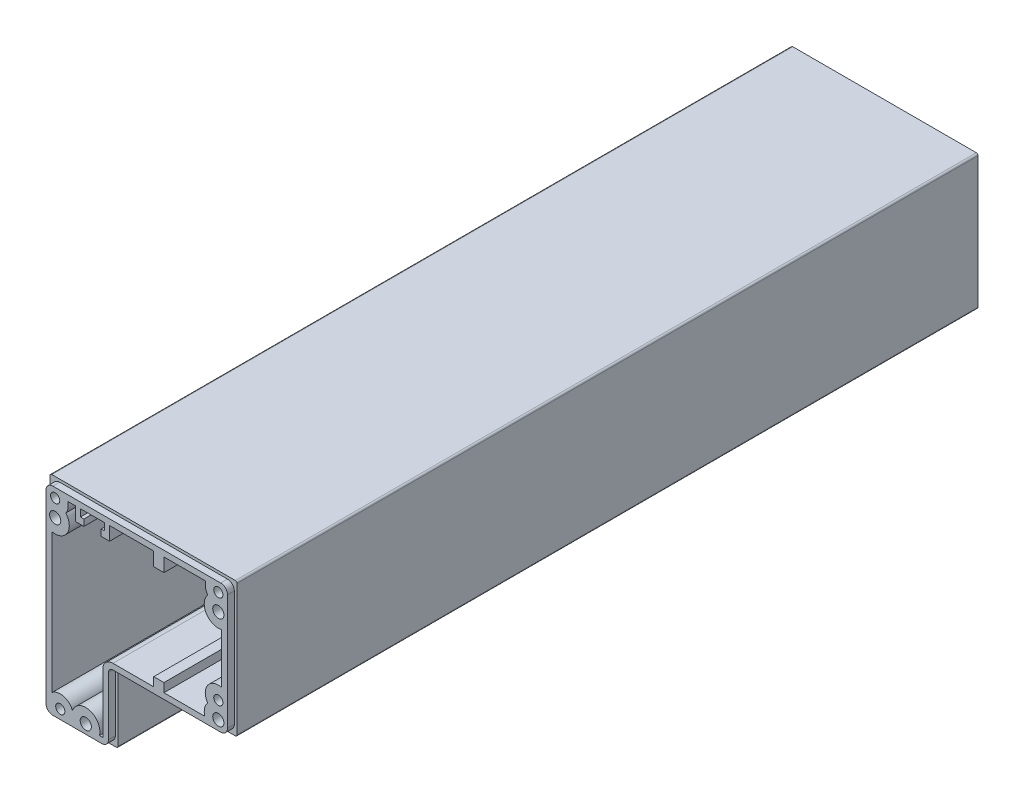
from build123d import *

# Parameters (mm, degrees)
SKETCH_1_W                       = 55
SKETCH_1_H                       = 60
EXTRUDE_1_DEPTH                  = 16.5
HOLE_WIZARD_3_6_3_6_1_D          = 3.6
HOLE_WIZARD_3_6_3_6_1_DEPTH      = 25
HOLE_WIZARD_3_6_3_6_1_TIP        = 1.081549114
HOLE_WIZARD_M2_5_1_D             = 2.05
HOLE_WIZARD_M2_5_1_DEPTH         = 14
HOLE_WIZARD_M2_5_1_TIP           = 0.615882135
SKETCH_8_W                       = 35
SKETCH_8_H                       = 20.4
CUT_EXTRUDE_1_DEPTH              = 44.914690025
CUT_EXTRUDE_START                = 2.5
SKETCH_9_W                       = 20
SKETCH_9_H                       = 6
CUT_EXTRUDE_2_DEPTH              = 42.414690025
SHELL_START                      = 1.8
SHELL_1_DEPTH                    = 14.7
EXTRUDE_2_DEPTH                  = 220
HOLE_WIZARD_1_AT_2_COUNT         = 2
HOLE_WIZARD_1_AT_2_PITCH         = 48
HOLE_WIZARD_1_AT_3_COUNT         = 2
HOLE_WIZARD_1_AT_3_PITCH         = 27.5
HOLE_WIZARD_1_AT_4_COUNT         = 2
HOLE_WIZARD_1_AT_4_PITCH         = 70.507091842
SKETCH_16_R                      = 3
CUT_EXTRUDE_4_DEPTH              = 12
FILLET_1_R                       = 0.5
FILLET_2_R                       = 0.5
SKETCH_20_W                      = 1.65
SKETCH_20_H                      = 220
HOLE_WIZARD_M4_1_AT_2_COUNT      = 2
HOLE_WIZARD_M4_1_AT_2_PITCH      = 27.5
HOLE_WIZARD_M4_1_AT_3_COUNT      = 2
HOLE_WIZARD_M4_1_AT_3_PITCH      = 61.846584384
HOLE_WIZARD_M4_1_AT_4_COUNT      = 2
HOLE_WIZARD_M4_1_AT_4_PITCH      = 48
SKETCH_22_W                      = 1.35
SKETCH_22_H                      = 236.5
HOLE_WIZARD_2_7_2_7_1_AT_2_COUNT = 2
HOLE_WIZARD_2_7_2_7_1_AT_2_PITCH = 27.5
HOLE_WIZARD_2_7_2_7_1_AT_3_COUNT = 2
HOLE_WIZARD_2_7_2_7_1_AT_3_PITCH = 48
HOLE_WIZARD_2_7_2_7_1_AT_4_COUNT = 2
HOLE_WIZARD_2_7_2_7_1_AT_4_PITCH = 70.507091842
SHELL_START_2                    = 16.5
SHELL_2_DEPTH                    = 220
EXTRUDE_1_2_DEPTH                = 220
SKETCH_25_W                      = 10
SKETCH_25_H                      = 4
EXTRUDE_3_DEPTH                  = 220
SKETCH_26_W                      = 7.1
SKETCH_26_H                      = 2.1
CUT_EXTRUDE_5_DEPTH              = 224.732541218
CUT_EXTRUDE_1_2_DEPTH            = 224.732541218
CUT_EXTRUDE_1_2_DEPTH_BACK       = 224.732541218
SKETCH_27_W                      = 5.1
SKETCH_27_H                      = 2.702569417
SKETCH_28_R                      = 75.950047439
CUT_EXTRUDE_6_DEPTH              = 2
FILLET_3_R                       = 2


# Read off the part's stored shape, not the designer's step: 抽壳1, 抽壳2
with BuildPart() as part:
    # 草图1 → Extrude 1 (new body)
    with BuildSketch(Plane.XY):
        Rectangle(SKETCH_1_W, SKETCH_1_H)
    extrude(amount=EXTRUDE_1_DEPTH)

    # Ø3.6 (3.6) 直径孔1
    with Locations(Plane.XY.offset(16.5)):
        with Locations((-24, 21.5), (24, 21.5), (24, -6), (-15, -26.5)):
            Hole(HOLE_WIZARD_3_6_3_6_1_D / 2, depth=HOLE_WIZARD_3_6_3_6_1_DEPTH)
            with Locations((0, 0, -(HOLE_WIZARD_3_6_3_6_1_DEPTH + HOLE_WIZARD_3_6_3_6_1_TIP / 2))):  # 118° drill point
                Cone(0, HOLE_WIZARD_3_6_3_6_1_D / 2, HOLE_WIZARD_3_6_3_6_1_TIP, mode=Mode.SUBTRACT)

    # M2.5 螺纹孔1
    with Locations(Plane.XY.offset(16.5)):
        with Locations((-24, 26.5), (24, 26.5), (24, -1), (-22.5, -26.5)):
            Hole(HOLE_WIZARD_M2_5_1_D / 2, depth=HOLE_WIZARD_M2_5_1_DEPTH)
            with Locations((0, 0, -(HOLE_WIZARD_M2_5_1_DEPTH + HOLE_WIZARD_M2_5_1_TIP / 2))):  # 118° drill point
                Cone(0, HOLE_WIZARD_M2_5_1_D / 2, HOLE_WIZARD_M2_5_1_TIP, mode=Mode.SUBTRACT)

    # 草图8 → Cut-Extrude 1 (cut, through all)
    with BuildSketch(Plane.XY.offset(16.5)):
        with Locations((10, -19.8)):
            Rectangle(SKETCH_8_W, SKETCH_8_H)
    extrude(amount=-CUT_EXTRUDE_1_DEPTH, mode=Mode.SUBTRACT)

    # 草图9 → 切除-拉伸2 (cut, through all)
    with BuildSketch(Plane(origin=(0, 0, 16.5), x_dir=(-1, 0, 0), z_dir=(0, 0, -1)).offset(CUT_EXTRUDE_START)):
        with Locations((17.5, -27)):
            Rectangle(SKETCH_9_W, SKETCH_9_H)
    extrude(amount=CUT_EXTRUDE_2_DEPTH, mode=Mode.SUBTRACT)

    # 抽壳1 outline → 抽壳1 (cut)
    with BuildSketch(Plane.XY.offset(SHELL_START)):
        with BuildLine():
            ThreePointArc((-21.743758657, 28.2), (-21.182110509, 26.299690696), (-22.006919283, 24.4979375))
            ThreePointArc((-22.006919283, 24.4979375), (-20.910890356, 19.651378458), (-25.7, 18.326673669))
            Line((-25.7, 18.326673669), (-25.7, -22.2))
            Line((-25.7, -22.2), (-9.3, -22.2))
            Line((-9.3, -22.2), (-9.3, -7.8))
            Line((-9.3, -7.8), (20.882308546, -7.8))
            ThreePointArc((20.882308546, -7.8), (20.494996561, -5.178446051), (22.006919283, -3.0020625))
            ThreePointArc((22.006919283, -3.0020625), (21.865811165, 0.8509087), (25.7, 1.256241343))
            Line((25.7, 1.256241343), (25.7, 18.326673669))
            ThreePointArc((25.7, 18.326673669), (20.910890356, 19.651378458), (22.006919283, 24.4979375))
            ThreePointArc((22.006919283, 24.4979375), (21.182110509, 26.299690696), (21.743758657, 28.2))
            Line((21.743758657, 28.2), (-21.743758657, 28.2))
        make_face()
    extrude(amount=SHELL_1_DEPTH, mode=Mode.SUBTRACT)


with BuildPart() as body_2:
    # 草图10 → 凸台-拉伸2 (new body)
    with BuildSketch(Plane.XY.offset(16.5)):
        Polygon((-27.5, -30), (-7.5, -30), (-7.5, -9.6), (27.5, -9.6), (27.5, 30), (-27.5, 30), align=None)
    extrude(amount=EXTRUDE_2_DEPTH)


with BuildPart() as hole_wizard_1_tool:
    # 草图13 → 打孔尺寸(%根据)内六角圆柱头螺钉的类型1 (revolve)
    with BuildSketch(Plane(origin=(24, 26.5, 236.5), x_dir=(0, -1, 0), z_dir=(1, 0, 0))):
        Polygon((0, 0), (0, 236.5), (1, 236.5), (1, 1.5), (1.05, 1.5), (1.05, 0), align=None)
    hole_wizard_1 = revolve(axis=Axis((24, 26.5, 242.85), (0, 0, -1)))


with BuildPart() as part_1:
    add(part.part)

    # 打孔尺寸(%根据)内六角圆柱头螺钉的类型1: cut by hole_wizard_1_tool
    add(hole_wizard_1_tool.part, mode=Mode.SUBTRACT)


with BuildPart() as body_2_1:
    add(body_2.part)

    # 打孔尺寸(%根据)内六角圆柱头螺钉的类型1: cut by hole_wizard_1_tool
    add(hole_wizard_1_tool.part, mode=Mode.SUBTRACT)


with BuildPart() as hole_wizard_1_at_2_tool:
    # 打孔尺寸(%根据)内六角圆柱头螺钉的类型1 at 2: 打孔尺寸(%根据)内六角圆柱头螺钉的类型1 ×2
    with Locations(*[(-i * HOLE_WIZARD_1_AT_2_PITCH, 0, 0) for i in range(1, HOLE_WIZARD_1_AT_2_COUNT)]):
        add(hole_wizard_1)


with BuildPart() as part_2:
    add(part_1.part)

    # 打孔尺寸(%根据)内六角圆柱头螺钉的类型1 at 2: cut by hole_wizard_1_at_2_tool
    add(hole_wizard_1_at_2_tool.part, mode=Mode.SUBTRACT)


with BuildPart() as body_2_2:
    add(body_2_1.part)

    # 打孔尺寸(%根据)内六角圆柱头螺钉的类型1 at 2: cut by hole_wizard_1_at_2_tool
    add(hole_wizard_1_at_2_tool.part, mode=Mode.SUBTRACT)


with BuildPart() as hole_wizard_1_at_3_tool:
    # 打孔尺寸(%根据)内六角圆柱头螺钉的类型1 at 3: 打孔尺寸(%根据)内六角圆柱头螺钉的类型1 ×2
    with Locations(*[(0, -i * HOLE_WIZARD_1_AT_3_PITCH, 0) for i in range(1, HOLE_WIZARD_1_AT_3_COUNT)]):
        add(hole_wizard_1)


with BuildPart() as part_3:
    add(part_2.part)

    # 打孔尺寸(%根据)内六角圆柱头螺钉的类型1 at 3: cut by hole_wizard_1_at_3_tool
    add(hole_wizard_1_at_3_tool.part, mode=Mode.SUBTRACT)

    # 草图16 → 切除-拉伸4 (cut)
    with BuildSketch(Plane(origin=(-7.5, 0, 0), x_dir=(0, 0, -1), z_dir=(1, 0, 0))):
        with Locations(Location((-8, -18, 0), (0, 0, 90))):
            Circle(SKETCH_16_R)
    extrude(amount=-CUT_EXTRUDE_4_DEPTH, mode=Mode.SUBTRACT)

    # 圆角1
    fillet_1_edges = [part_3.edges().sort_by_distance(p)[0] for p in [
        (-27.5, 3, 0),
        (0, 30, 0),
        (27.5, 10.2, 0),
        (27.5, -9.6, 8.25),
        (-7.5, -16.8, 0),
        (10, -9.6, 0),
        (-7.5, -9.6, 8.25),
        (-7.5, -30, 15.25),
        (-27.5, -30, 15.25),
        (-27.5, 30, 8.25),
        (27.5, 30, 8.25),
        (-17.5, -24, 0),
        (-7.5, -24, 7),
        (-27.5, -24, 7),
    ]]
    fillet(fillet_1_edges, radius=FILLET_1_R)


with BuildPart() as body_2_3:
    add(body_2_2.part)

    # 打孔尺寸(%根据)内六角圆柱头螺钉的类型1 at 3: cut by hole_wizard_1_at_3_tool
    add(hole_wizard_1_at_3_tool.part, mode=Mode.SUBTRACT)

    # 打孔尺寸(%根据)内六角圆柱头螺钉的类型1 at 4: 打孔尺寸(%根据)内六角圆柱头螺钉的类型1 ×2
    with Locations(*[Vector(-0.6595081258531857, -0.7516974337681476, 0) * (i * HOLE_WIZARD_1_AT_4_PITCH) for i in range(1, HOLE_WIZARD_1_AT_4_COUNT)]):
        add(hole_wizard_1, mode=Mode.SUBTRACT)

    # 圆角2
    fillet_2_edges = [body_2_3.edges().sort_by_distance(p)[0] for p in [
        (-27.5, 30, 126.5),
        (27.5, 30, 126.5),
        (27.5, -9.6, 126.5),
        (-7.5, -9.6, 126.5),
        (-7.5, -30, 126.5),
        (-27.5, -30, 126.5),
    ]]
    fillet(fillet_2_edges, radius=FILLET_2_R)

    # 草图20 → M4 螺纹孔1 (revolve, cut)
    with BuildSketch(Plane(origin=(24, 21.5, 16.5), x_dir=(0, 1, 0), z_dir=(1, 0, 0))):
        with Locations((0.825, 110)):
            Rectangle(SKETCH_20_W, SKETCH_20_H)
    hole_wizard_m4_1 = revolve(axis=Axis((24, 21.5, 10.15), (0, 0, 1)), mode=Mode.SUBTRACT)

    # M4 螺纹孔1 at 2: M4 螺纹孔1 ×2
    with Locations(*[(0, -i * HOLE_WIZARD_M4_1_AT_2_PITCH, 0) for i in range(1, HOLE_WIZARD_M4_1_AT_2_COUNT)]):
        add(hole_wizard_m4_1, mode=Mode.SUBTRACT)

    # M4 螺纹孔1 at 3: M4 螺纹孔1 ×2
    with Locations(*[Vector(-0.6305926250944656, -0.7761140001162656, 0) * (i * HOLE_WIZARD_M4_1_AT_3_PITCH) for i in range(1, HOLE_WIZARD_M4_1_AT_3_COUNT)]):
        add(hole_wizard_m4_1, mode=Mode.SUBTRACT)

    # M4 螺纹孔1 at 4: M4 螺纹孔1 ×2
    with Locations(*[(-i * HOLE_WIZARD_M4_1_AT_4_PITCH, 0, 0) for i in range(1, HOLE_WIZARD_M4_1_AT_4_COUNT)]):
        add(hole_wizard_m4_1, mode=Mode.SUBTRACT)


with BuildPart() as hole_wizard_2_7_2_7_1_tool:
    # 草图22 → Ø2.7 (2.7) 直径孔1 (revolve)
    with BuildSketch(Plane(origin=(24, 26.5, 236.5), x_dir=(0, -1, 0), z_dir=(1, 0, 0))):
        with Locations((0.675, 118.25)):
            Rectangle(SKETCH_22_W, SKETCH_22_H)
    hole_wizard_2_7_2_7_1 = revolve(axis=Axis((24, 26.5, 242.85), (0, 0, -1)))


with BuildPart() as part_4:
    add(part_3.part)

    # Ø2.7 (2.7) 直径孔1: cut by hole_wizard_2_7_2_7_1_tool
    add(hole_wizard_2_7_2_7_1_tool.part, mode=Mode.SUBTRACT)


with BuildPart() as body_2_4:
    add(body_2_3.part)

    # Ø2.7 (2.7) 直径孔1: cut by hole_wizard_2_7_2_7_1_tool
    add(hole_wizard_2_7_2_7_1_tool.part, mode=Mode.SUBTRACT)


with BuildPart() as hole_wizard_2_7_2_7_1_at_2_tool:
    # Ø2.7 (2.7) 直径孔1 at 2: Ø2.7 (2.7) 直径孔1 ×2
    with Locations(*[(0, -i * HOLE_WIZARD_2_7_2_7_1_AT_2_PITCH, 0) for i in range(1, HOLE_WIZARD_2_7_2_7_1_AT_2_COUNT)]):
        add(hole_wizard_2_7_2_7_1)


with BuildPart() as part_5:
    add(part_4.part)

    # Ø2.7 (2.7) 直径孔1 at 2: cut by hole_wizard_2_7_2_7_1_at_2_tool
    add(hole_wizard_2_7_2_7_1_at_2_tool.part, mode=Mode.SUBTRACT)


with BuildPart() as body_2_5:
    add(body_2_4.part)

    # Ø2.7 (2.7) 直径孔1 at 2: cut by hole_wizard_2_7_2_7_1_at_2_tool
    add(hole_wizard_2_7_2_7_1_at_2_tool.part, mode=Mode.SUBTRACT)


with BuildPart() as hole_wizard_2_7_2_7_1_at_3_tool:
    # Ø2.7 (2.7) 直径孔1 at 3: Ø2.7 (2.7) 直径孔1 ×2
    with Locations(*[(-i * HOLE_WIZARD_2_7_2_7_1_AT_3_PITCH, 0, 0) for i in range(1, HOLE_WIZARD_2_7_2_7_1_AT_3_COUNT)]):
        add(hole_wizard_2_7_2_7_1)


with BuildPart() as part_6:
    add(part_5.part)

    # Ø2.7 (2.7) 直径孔1 at 3: cut by hole_wizard_2_7_2_7_1_at_3_tool
    add(hole_wizard_2_7_2_7_1_at_3_tool.part, mode=Mode.SUBTRACT)


with BuildPart() as body_2_6:
    add(body_2_5.part)

    # Ø2.7 (2.7) 直径孔1 at 3: cut by hole_wizard_2_7_2_7_1_at_3_tool
    add(hole_wizard_2_7_2_7_1_at_3_tool.part, mode=Mode.SUBTRACT)


with BuildPart() as hole_wizard_2_7_2_7_1_at_4_tool:
    # Ø2.7 (2.7) 直径孔1 at 4: Ø2.7 (2.7) 直径孔1 ×2
    with Locations(*[Vector(-0.6595081258531857, -0.7516974337681476, 0) * (i * HOLE_WIZARD_2_7_2_7_1_AT_4_PITCH) for i in range(1, HOLE_WIZARD_2_7_2_7_1_AT_4_COUNT)]):
        add(hole_wizard_2_7_2_7_1)


with BuildPart() as part_7:
    add(part_6.part)

    # Ø2.7 (2.7) 直径孔1 at 4: cut by hole_wizard_2_7_2_7_1_at_4_tool
    add(hole_wizard_2_7_2_7_1_at_4_tool.part, mode=Mode.SUBTRACT)


with BuildPart() as body_2_7:
    add(body_2_6.part)

    # Ø2.7 (2.7) 直径孔1 at 4: cut by hole_wizard_2_7_2_7_1_at_4_tool
    add(hole_wizard_2_7_2_7_1_at_4_tool.part, mode=Mode.SUBTRACT)

    # 抽壳2 outline → 抽壳2 (cut)
    with BuildSketch(Plane.XY.offset(SHELL_START_2)):
        with BuildLine():
            ThreePointArc((20.883126567, 24.24), (20.213800969, 25.802005085), (20.282137711, 27.5))
            Line((20.282137711, 27.5), (-20.282137711, 27.5))
            ThreePointArc((-20.282137711, 27.5), (-20.213800969, 25.802005085), (-20.883126567, 24.24))
            ThreePointArc((-20.883126567, 24.24), (-20.454469736, 19.343216481), (-25, 17.472283525))
            Line((-25, 17.472283525), (-25, -23.572116806))
            ThreePointArc((-25, -23.572116806), (-21.557842707, -22.767060189), (-18.91, -25.109172908))
            ThreePointArc((-18.91, -25.109172908), (-13.803138338, -22.526333914), (-10.972283525, -27.5))
            Line((-10.972283525, -27.5), (-10, -27.5))
            Line((-10, -27.5), (-10, -10.1))
            ThreePointArc((-10, -10.1), (-9.121320344, -7.978679656), (-7, -7.1))
            Line((-7, -7.1), (19.998437805, -7.1))
            ThreePointArc((19.998437805, -7.1), (19.955938743, -5.068298035), (20.883126567, -3.26))
            ThreePointArc((20.883126567, -3.26), (20.829196053, 1.183690072), (25, 2.717862289))
            Line((25, 2.717862289), (25, 17.472283525))
            ThreePointArc((25, 17.472283525), (20.454469736, 19.343216481), (20.883126567, 24.24))
        make_face()
    extrude(amount=SHELL_2_DEPTH, mode=Mode.SUBTRACT)

    # 草图24 → Extrude 1 2 (add)
    with BuildSketch(Plane.XY.offset(236.5)):
        Polygon((8, 23.5), (8, 25.5), (8, 27.5), (5, 27.5), (5, 25.5), (5, 23.5), align=None)
        Polygon((5, -4.5), (5, -6.5), (5, -7.658100232), (8, -7.658100232), (8, -6.5), (8, -4.5), align=None)
    extrude(amount=-EXTRUDE_1_2_DEPTH)

    # 草图25 → 凸台-拉伸3 (add)
    with BuildSketch(Plane.XY.offset(236.5)):
        with Locations((-13, 25.5)):
            Rectangle(SKETCH_25_W, SKETCH_25_H)
    extrude(amount=-EXTRUDE_3_DEPTH)

    # 草图26 → 切除-拉伸5 (cut, through all)
    with BuildSketch(Plane.XY.offset(236.5)):
        with Locations((-13, 26.45)):
            Rectangle(SKETCH_26_W, SKETCH_26_H)
    extrude(amount=-CUT_EXTRUDE_5_DEPTH, mode=Mode.SUBTRACT)

    # 草图27 → Cut-Extrude 1 2 (cut, two sides: drawn at the far end of the back side and taken through both)
    with BuildSketch(Plane.XY.offset(236.5).offset(-CUT_EXTRUDE_1_2_DEPTH_BACK)):
        with Locations((-13, 24.048715292)):
            Rectangle(SKETCH_27_W, SKETCH_27_H)
    extrude(amount=CUT_EXTRUDE_1_2_DEPTH + CUT_EXTRUDE_1_2_DEPTH_BACK, mode=Mode.SUBTRACT)

    # 草图28 → 切除-拉伸6 (cut)
    with BuildSketch(Plane.XY.offset(236.5)):
        Circle(SKETCH_28_R)
        with BuildLine():
            Line((-26.7, -29.2), (-8.3, -29.2))
            Line((-8.3, -29.2), (-8.3, -10.1))
            ThreePointArc((-8.3, -10.1), (-7.919238816, -9.180761184), (-7, -8.8))
            Line((-7, -8.8), (26.7, -8.8))
            Line((26.7, -8.8), (26.7, 29.2))
            Line((26.7, 29.2), (-26.7, 29.2))
            Line((-26.7, 29.2), (-26.7, -29.2))
        make_face(mode=Mode.SUBTRACT)
    extrude(amount=-CUT_EXTRUDE_6_DEPTH, mode=Mode.SUBTRACT)

    # 圆角3
    fillet_3_edges = [body_2_7.edges().sort_by_distance(p)[0] for p in [
        (-26.7, 29.2, 235.5),
        (26.7, 29.2, 235.5),
        (26.7, -8.8, 235.5),
        (-8.3, -29.2, 235.5),
        (-26.7, -29.2, 235.5),
    ]]
    fillet(fillet_3_edges, radius=FILLET_3_R)


solid = body_2_7.part
